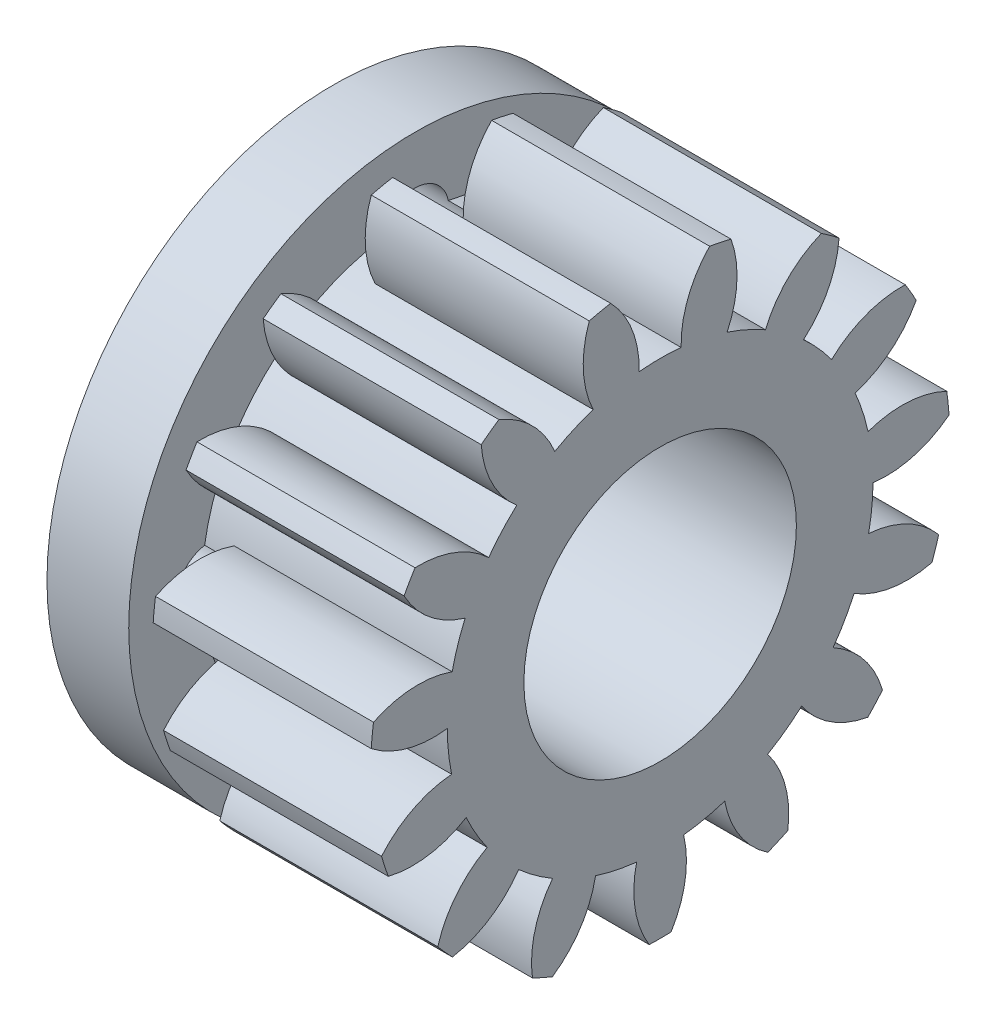
from build123d import *

# Parameters (mm, degrees)
OTHER_269_OUTLINE_R = 2.5
OTHER_269_DEPTH     = 8
EXTRUDE_START       = 4
SKETCH_1_R          = 7.8115
EXTRUDE_1_DEPTH     = 4
SKETCH_2_R          = 10.5
EXTRUDE_2_DEPTH     = 3
SKETCH_3_R          = 5
CUT_EXTRUDE_1_DEPTH = 18
SKETCH_4_R          = 1.25
CUT_EXTRUDE_2_DEPTH = 4


# Read off the part's stored shape, not the designer's step: звезда к рейки
with BuildPart() as part:
    # Other 269 outline → Other 269 (new body)
    with BuildSketch(Plane.YZ):
        with BuildLine():
            ThreePointArc((1.50889806, 10.517311997), (1.110614922, 10.566795138), (0.710747103, 10.601201043))
            ThreePointArc((0.710747103, 10.601201043), (0.052768817, 9.282126803), (-0.045978646, 7.811364683))
            ThreePointArc((-0.045978646, 7.811364683), (-0.816524091, 7.768707786), (-1.579100136, 7.650227121))
            ThreePointArc((-1.579100136, 7.650227121), (-1.98147837, 9.068318808), (-2.899329207, 10.221766733))
            ThreePointArc((-2.899329207, 10.221766733), (-3.283305565, 10.104975486), (-3.662597137, 9.973765949))
            ThreePointArc((-3.662597137, 9.973765949), (-3.727174383, 8.50110779), (-3.219171833, 7.117335524))
            ThreePointArc((-3.219171833, 7.117335524), (-3.90575, 6.764957442), (-4.554207455, 6.346552348))
            ThreePointArc((-4.554207455, 6.346552348), (-5.498588115, 7.478381595), (-6.806236115, 8.158785139))
            ThreePointArc((-6.806236115, 8.158785139), (-7.109512693, 7.895913771), (-7.402645059, 7.621776114))
            ThreePointArc((-7.402645059, 7.621776114), (-6.862655273, 6.250170009), (-5.835740964, 5.192654394))
            ThreePointArc((-5.835740964, 5.192654394), (-6.319636252, 4.591484498), (-6.741850931, 3.945501017))
            ThreePointArc((-6.741850931, 3.945501017), (-8.064942021, 4.595364266), (-9.536282966, 4.685075474))
            ThreePointArc((-9.536282966, 4.685075474), (-9.706420487, 4.321576832), (-9.862708399, 3.951911947))
            ThreePointArc((-9.862708399, 3.951911947), (-8.81152072, 2.918521053), (-7.443257466, 2.370116145))
            ThreePointArc((-7.443257466, 2.370116145), (-7.640799983, 1.624102173), (-7.763767133, 0.862236717))
            ThreePointArc((-7.763767133, 0.862236717), (-9.236794185, 0.917766707), (-10.617419857, 0.401273697))
            ThreePointArc((-10.617419857, 0.401273697), (-10.625, 0), (-10.617419857, -0.401273697))
            ThreePointArc((-10.617419857, -0.401273697), (-9.236794185, -0.917766707), (-7.763767133, -0.862236717))
            ThreePointArc((-7.763767133, -0.862236717), (-7.640799983, -1.624102173), (-7.443257466, -2.370116145))
            ThreePointArc((-7.443257466, -2.370116145), (-8.81152072, -2.918521053), (-9.862708399, -3.951911947))
            ThreePointArc((-9.862708399, -3.951911947), (-9.706420487, -4.321576832), (-9.536282966, -4.685075474))
            ThreePointArc((-9.536282966, -4.685075474), (-8.064942021, -4.595364266), (-6.741850931, -3.945501017))
            ThreePointArc((-6.741850931, -3.945501017), (-6.319636252, -4.591484498), (-5.835740964, -5.192654394))
            ThreePointArc((-5.835740964, -5.192654394), (-6.862655273, -6.250170009), (-7.402645059, -7.621776114))
            ThreePointArc((-7.402645059, -7.621776114), (-7.109512693, -7.895913771), (-6.806236115, -8.158785139))
            ThreePointArc((-6.806236115, -8.158785139), (-5.498588115, -7.478381595), (-4.554207455, -6.346552348))
            ThreePointArc((-4.554207455, -6.346552348), (-3.90575, -6.764957442), (-3.219171833, -7.117335524))
            ThreePointArc((-3.219171833, -7.117335524), (-3.727174383, -8.50110779), (-3.662597137, -9.973765949))
            ThreePointArc((-3.662597137, -9.973765949), (-3.283305565, -10.104975486), (-2.899329207, -10.221766733))
            ThreePointArc((-2.899329207, -10.221766733), (-1.98147837, -9.068318808), (-1.579100136, -7.650227121))
            ThreePointArc((-1.579100136, -7.650227121), (-0.816524091, -7.768707786), (-0.045978646, -7.811364683))
            ThreePointArc((-0.045978646, -7.811364683), (0.052768817, -9.282126803), (0.710747103, -10.601201043))
            ThreePointArc((0.710747103, -10.601201043), (1.110614922, -10.566795138), (1.50889806, -10.517311997))
            ThreePointArc((1.50889806, -10.517311997), (1.878246986, -9.090261316), (1.669047941, -7.631108125))
            ThreePointArc((1.669047941, -7.631108125), (2.413886252, -7.429177977), (3.135164666, -7.154737925))
            ThreePointArc((3.135164666, -7.154737925), (3.82358781, -8.458181767), (4.961196713, -9.395592168))
            ThreePointArc((4.961196713, -9.395592168), (5.3125, -9.201519915), (5.656223144, -8.99431847))
            ThreePointArc((5.656223144, -8.99431847), (5.413206375, -7.54041506), (4.628602467, -6.292501208))
            ThreePointArc((4.628602467, -6.292501208), (5.226913732, -5.805075804), (5.774209525, -5.26099198))
            ThreePointArc((5.774209525, -5.26099198), (6.933273734, -6.171740263), (8.353810339, -6.56540005))
            ThreePointArc((8.353810339, -6.56540005), (8.595805565, -6.245218306), (8.825535862, -5.916125569))
            ThreePointArc((8.825535862, -5.916125569), (8.012173204, -4.686762538), (6.787829577, -3.865863666))
            ThreePointArc((6.787829577, -3.865863666), (7.136160342, -3.177223287), (7.4148411, -2.457572728))
            ThreePointArc((7.4148411, -2.457572728), (8.844133643, -2.818148799), (10.301974266, -2.599990619))
            ThreePointArc((10.301974266, -2.599990619), (10.392818258, -2.209061715), (10.468833252, -1.81498081))
            ThreePointArc((10.468833252, -1.81498081), (9.225762498, -1.022726195), (7.773379287, -0.770783176))
            ThreePointArc((7.773379287, -0.770783176), (7.8115, 0), (7.773379287, 0.770783176))
            ThreePointArc((7.773379287, 0.770783176), (9.225762498, 1.022726195), (10.468833252, 1.81498081))
            ThreePointArc((10.468833252, 1.81498081), (10.392818258, 2.209061715), (10.301974266, 2.599990619))
            ThreePointArc((10.301974266, 2.599990619), (8.844133643, 2.818148799), (7.4148411, 2.457572728))
            ThreePointArc((7.4148411, 2.457572728), (7.136160342, 3.177223287), (6.787829577, 3.865863666))
            ThreePointArc((6.787829577, 3.865863666), (8.012173204, 4.686762538), (8.825535862, 5.916125569))
            ThreePointArc((8.825535862, 5.916125569), (8.595805565, 6.245218306), (8.353810339, 6.56540005))
            ThreePointArc((8.353810339, 6.56540005), (6.933273734, 6.171740263), (5.774209525, 5.26099198))
            ThreePointArc((5.774209525, 5.26099198), (5.226913732, 5.805075804), (4.628602467, 6.292501208))
            ThreePointArc((4.628602467, 6.292501208), (5.413206375, 7.54041506), (5.656223144, 8.99431847))
            ThreePointArc((5.656223144, 8.99431847), (5.3125, 9.201519915), (4.961196713, 9.395592168))
            ThreePointArc((4.961196713, 9.395592168), (3.82358781, 8.458181767), (3.135164666, 7.154737925))
            ThreePointArc((3.135164666, 7.154737925), (2.413886252, 7.429177977), (1.669047941, 7.631108125))
            ThreePointArc((1.669047941, 7.631108125), (1.878246986, 9.090261316), (1.50889806, 10.517311997))
        make_face()
        Circle(OTHER_269_OUTLINE_R, mode=Mode.SUBTRACT)
    extrude(amount=OTHER_269_DEPTH)

    # Эскиз1 → Бобышка-Вытянуть1 (add)
    with BuildSketch(Plane.ZY.offset(EXTRUDE_START)):
        Circle(SKETCH_1_R)
    extrude(amount=-EXTRUDE_1_DEPTH)

    # Эскиз2 → Бобышка-Вытянуть2 (add)
    with BuildSketch(Plane.ZY.offset(4)):
        Circle(SKETCH_2_R)
    extrude(amount=-EXTRUDE_2_DEPTH)

    # Эскиз3 → Вырез-Вытянуть1 (cut)
    with BuildSketch(Plane(origin=(8, 0, 0), x_dir=(0, 0, -1), z_dir=(1, 0, 0))):
        Circle(SKETCH_3_R)
    extrude(amount=-CUT_EXTRUDE_1_DEPTH, mode=Mode.SUBTRACT)

    # Эскиз4 → Вырез-Вытянуть2 (cut)
    with BuildSketch(Plane.ZY.offset(4)):
        with Locations((-7.5, 0)):
            Circle(SKETCH_4_R)
        with Locations((0, -7.474046633)):
            Circle(SKETCH_4_R)
        with Locations(Location((7.5, 0, 0), (0, 0, 279.848392372))):
            Circle(SKETCH_4_R)
        with Locations(Location((0, 7.474046633, 0), (0, 0, 11.094887122))):
            Circle(SKETCH_4_R)
    extrude(amount=-CUT_EXTRUDE_2_DEPTH, mode=Mode.SUBTRACT)


solid = part.part
